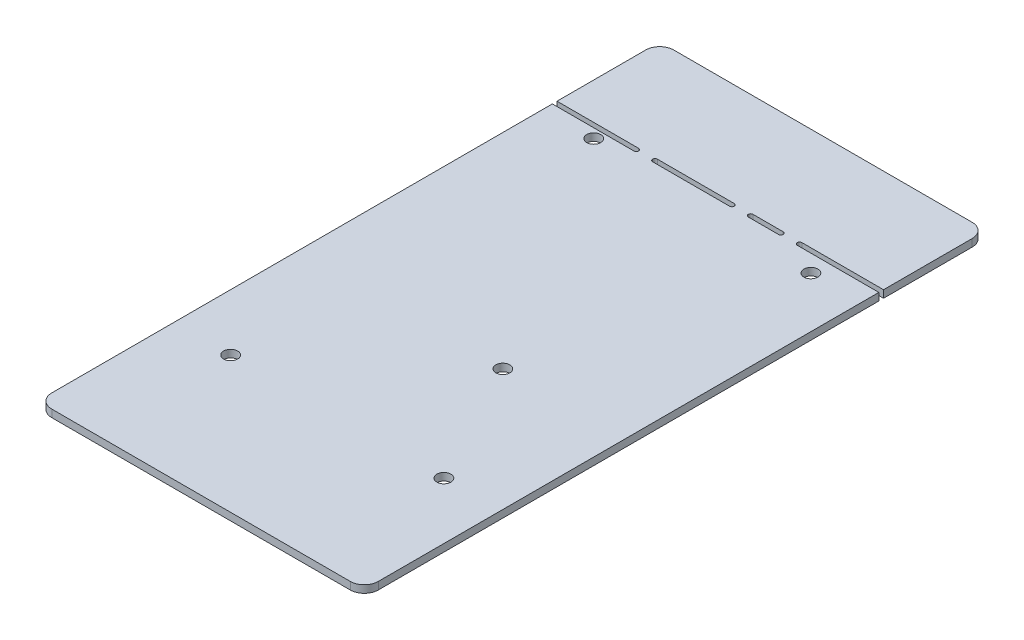
from build123d import *

# Parameters (mm, degrees)
SKETCH_1_W          = 70
SKETCH_1_H          = 133.34
EXTRUDE_1_DEPTH     = 1.6
SKETCH_2_R          = 1.5
SKETCH_2_W          = 18
SKETCH_2_H          = 1
SKETCH_2_W_2        = 17.5
SKETCH_2_W_3        = 7.5
CUT_EXTRUDE_1_DEPTH = 76.315661718
FILLET_1_R          = 3
FILLET_2_R          = 0.5


with BuildPart() as part:
    # ｽｹｯﾁ1 → ﾎﾞｽ - 押し出し1 (new body)
    with BuildSketch(Plane(origin=(0, 0, 0), x_dir=(1, 0, 0), z_dir=(0, 1, 0))):
        Rectangle(SKETCH_1_W, SKETCH_1_H)
    extrude(amount=EXTRUDE_1_DEPTH)

    # ｽｹｯﾁ2 → ｶｯﾄ - 押し出し1 (cut, through all)
    with BuildSketch(Plane(origin=(0, 1.6, 0), x_dir=(1, 0, 0), z_dir=(0, 1, 0))):
        with Locations(Location((-22.86, -37.46, 0), (0, 0, 270))):
            Circle(SKETCH_2_R)
        with Locations(Location((22.86, -37.46, 0), (0, 0, 90))):
            Circle(SKETCH_2_R)
        with Locations(Location((-24.13, 41.65, 0), (0, 0, 270))):
            Circle(SKETCH_2_R)
        with Locations(Location((24.13, 39.95, 0), (0, 0, 270))):
            Circle(SKETCH_2_R)
        with Locations(Location((8.89, -10.85, 0), (0, 0, 270))):
            Circle(SKETCH_2_R)
        with Locations((-26, 44.15)):
            Rectangle(SKETCH_2_W, SKETCH_2_H)
        with Locations((26, 44.15)):
            Rectangle(SKETCH_2_W, SKETCH_2_H)
        with Locations((-5.25, 44.15)):
            Rectangle(SKETCH_2_W_2, SKETCH_2_H)
        with Locations((10.25, 44.15)):
            Rectangle(SKETCH_2_W_3, SKETCH_2_H)
    extrude(amount=-CUT_EXTRUDE_1_DEPTH, mode=Mode.SUBTRACT)

    # ﾌｨﾚｯﾄ1
    fillet_1_edges = [part.edges().sort_by_distance(p)[0] for p in [
        (35, 0.8, 66.67),
        (-35, 0.8, 66.67),
        (-35, 0.8, -66.67),
        (35, 0.8, -66.67),
    ]]
    fillet(fillet_1_edges, radius=FILLET_1_R)

    # ﾌｨﾚｯﾄ2
    fillet_2_edges = [part.edges().sort_by_distance(p)[0] for p in [
        (17, 0.8, -44.65),
        (17, 0.8, -43.65),
        (14, 0.8, -43.65),
        (14, 0.8, -44.65),
        (6.5, 0.8, -44.65),
        (6.5, 0.8, -43.65),
        (3.5, 0.8, -43.65),
        (3.5, 0.8, -44.65),
        (-17, 0.8, -44.65),
        (-17, 0.8, -43.65),
        (-14, 0.8, -43.65),
        (-14, 0.8, -44.65),
    ]]
    fillet(fillet_2_edges, radius=FILLET_2_R - 0.0001)  # a hair under: the kernel refuses the full size


solid = part.part
